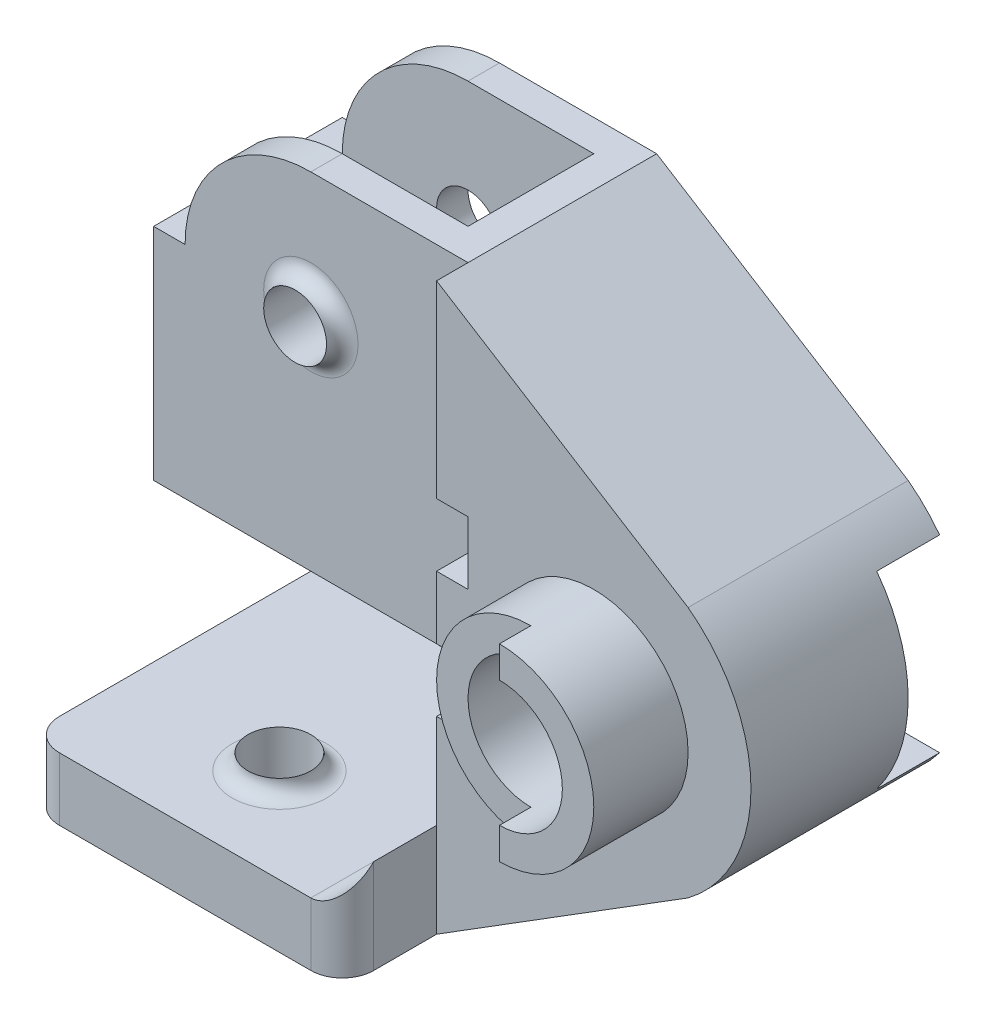
from build123d import *
from build123d.topology import SkipClean

# Parameters (mm, degrees)
SKETCH1_R           = 1
BOSS_EXTRUDE1_DEPTH = 10
SKETCH2_W           = 1
SKETCH2_H           = 2
SKETCH2_W_2         = 2
SKETCH2_H_2         = 3
CUT_EXTRUDE1_DEPTH  = 20
SKETCH3_W           = 11.356791525
SKETCH3_H           = 18.189557321
SKETCH3_R           = 3
CUT_EXTRUDE2_DEPTH  = 3
SKETCH4_R           = 2
CUT_EXTRUDE3_DEPTH  = 4
CUT_EXTRUDE4_START  = -2
CUT_EXTRUDE4_DEPTH  = 2
CUT_EXTRUDE5_START  = -2
SKETCH6_R           = 2
CUT_EXTRUDE5_DEPTH  = 2
SKETCH7_W           = 8
SKETCH7_H           = 4
CUT_EXTRUDE6_DEPTH  = 8
FILLET1_R           = 1
SKETCH9_R           = 1
CUT_EXTRUDE8_DEPTH  = 3
CUT_EXTRUDE9_DEPTH  = 9
CUT_EXTRUDE10_START = -4
SKETCH11_R          = 1
CUT_EXTRUDE10_DEPTH = 4
CUT_EXTRUDE11_DEPTH = 4
CUT_EXTRUDE12_DEPTH = 27
SKETCH14_R          = 1
CUT_EXTRUDE13_DEPTH = 27


with BuildPart() as part:
    # Sketch1 → Boss-Extrude1 (new body)
    with BuildSketch(Plane.XY):
        with BuildLine():
            Line((0, 0), (0, 14))
            Line((0, 14), (1, 14))
            ThreePointArc((1, 14), (2.171572875, 16.828427125), (5, 18))
            Line((5, 18), (10, 18))
            Line((10, 18), (18, 13))
            ThreePointArc((18, 13), (20, 9), (18, 5))
            Line((18, 5), (10, 0))
            Line((10, 0), (0, 0))
        make_face()
        with Locations((5, 14)):
            Circle(SKETCH1_R, mode=Mode.SUBTRACT)
        with Locations((15, 9)):
            Circle(SKETCH1_R, mode=Mode.SUBTRACT)
    extrude(amount=BOSS_EXTRUDE1_DEPTH)

    # Sketch2 → Cut-Extrude1 (cut)
    with BuildSketch(Plane(origin=(0, 18, 0), x_dir=(1, 0, 0), z_dir=(0, 1, 0))):
        with Locations((19.5, -1)):
            Rectangle(SKETCH2_W, SKETCH2_H)
        with Locations((19, -8.5)):
            Rectangle(SKETCH2_W_2, SKETCH2_H_2)
        Polygon((10, -7), (10, -10), (15, -10), (15, -9), (12, -9), (12, -7), align=None)
    extrude(amount=-CUT_EXTRUDE1_DEPTH, mode=Mode.SUBTRACT)

    # Sketch3 → Cut-Extrude2 (cut)
    with BuildSketch(Plane.XY.offset(10)):
        with Locations((15.678395763, 9.094778661)):
            Rectangle(SKETCH3_W, SKETCH3_H)
        with Locations((15, 9)):
            Circle(SKETCH3_R, mode=Mode.SUBTRACT)
    extrude(amount=-CUT_EXTRUDE2_DEPTH, mode=Mode.SUBTRACT)

    # Sketch4 → Cut-Extrude3 (cut)
    with BuildSketch(Plane.XY.offset(10)):
        with Locations((15, 9)):
            Circle(SKETCH4_R)
    extrude(amount=-CUT_EXTRUDE3_DEPTH, mode=Mode.SUBTRACT)

    # Sketch5 → Cut-Extrude4 (cut)
    with BuildSketch(Plane(origin=(0, 0, 0), x_dir=(-1, 0, 0), z_dir=(0, 0, -1)).offset(CUT_EXTRUDE4_START)):
        with BuildLine():
            Line((-15, 6), (-23.076049943, 6))
            ThreePointArc((-23.076049943, 6), (-26.076049943, 9), (-23.076049943, 12))
            Line((-23.076049943, 12), (-15, 12))
            ThreePointArc((-15, 12), (-12, 9), (-15, 6))
        make_face()
    extrude(amount=CUT_EXTRUDE4_DEPTH, mode=Mode.SUBTRACT)

    # Sketch6 → Cut-Extrude5 (cut)
    with BuildSketch(Plane(origin=(0, 0, 2), x_dir=(-1, 0, 0), z_dir=(0, 0, -1)).offset(CUT_EXTRUDE5_START)):
        with Locations((-15, 9)):
            Circle(SKETCH6_R)
    extrude(amount=CUT_EXTRUDE5_DEPTH, mode=Mode.SUBTRACT)

    # Sketch7 → Cut-Extrude6 (cut)
    with BuildSketch(Plane(origin=(0, 18, 0), x_dir=(1, 0, 0), z_dir=(0, 1, 0))):
        with Locations((5, -3)):
            Rectangle(SKETCH7_W, SKETCH7_H)
    extrude(amount=-CUT_EXTRUDE6_DEPTH, mode=Mode.SUBTRACT)

    # Fillet1
    fillet1_edges = [part.edges().sort_by_distance(p)[0] for p in [
        (1, 10, 3),
        (9, 10, 3),
    ]]
    fillet(fillet1_edges, radius=FILLET1_R)

    # Sketch9 → Cut-Extrude8 (cut)
    with BuildSketch(Plane(origin=(0, 10, 0), x_dir=(1, 0, 0), z_dir=(0, 1, 0))):
        with Locations((7, -3)):
            Circle(SKETCH9_R)
        with Locations((3, -3)):
            Circle(SKETCH9_R)
    extrude(amount=-CUT_EXTRUDE8_DEPTH, mode=Mode.SUBTRACT)

    # Sketch10 → Cut-Extrude9 (cut)
    with BuildSketch(Plane.XY.offset(10)):
        with BuildLine():
            Line((0, 7), (9, 7))
            ThreePointArc((9, 7), (9.707106781, 6.707106781), (10, 6))
            Line((10, 6), (10, 3))
            ThreePointArc((10, 3), (9.707106781, 2.292893219), (9, 2))
            Line((9, 2), (0, 2))
            Line((0, 2), (0, 7))
        make_face()
    extrude(amount=-CUT_EXTRUDE9_DEPTH, mode=Mode.SUBTRACT)

    # Sketch11 → Cut-Extrude10 (cut)
    with BuildSketch(Plane.XY.offset(10).offset(CUT_EXTRUDE10_START)):
        with BuildLine():
            Line((10, 8), (10, 10))
            Line((10, 10), (11, 10))
            Line((11, 10), (11, 12))
            Line((11, 12), (10, 12))
            Line((10, 12), (10, 18))
            Line((10, 18), (5, 18))
            ThreePointArc((5, 18), (2.171572875, 16.828427125), (1, 14))
            Line((1, 14), (0, 14))
            Line((0, 14), (0, 7))
            Line((0, 7), (9, 7))
            ThreePointArc((9, 7), (9.707106781, 6.707106781), (10, 6))
            Line((10, 6), (11, 6))
            Line((11, 6), (11, 8))
            Line((11, 8), (10, 8))
        make_face()
        with Locations((5, 14)):
            Circle(SKETCH11_R, mode=Mode.SUBTRACT)
    extrude(amount=CUT_EXTRUDE10_DEPTH, mode=Mode.SUBTRACT)

    # Sketch12 → Cut-Extrude11 (cut)
    with BuildSketch(Plane.XY.offset(1)):
        with BuildLine():
            Line((2, 4), (-2.189178963, 4))
            ThreePointArc((-2.189178963, 4), (-3.189178963, 5), (-2.189178963, 6))
            Line((-2.189178963, 6), (2, 6))
            ThreePointArc((2, 6), (3, 5), (2, 4))
        make_face()
    extrude(amount=-CUT_EXTRUDE11_DEPTH, mode=Mode.SUBTRACT)

    # Sketch13 → Cut-Extrude12 (cut)
    with BuildSketch(Plane(origin=(0, 18, 0), x_dir=(1, 0, 0), z_dir=(0, 1, 0))):
        with BuildLine():
            Line((10, -9), (10, -10))
            Line((10, -10), (9, -10))
            ThreePointArc((9, -10), (9.707106781, -9.707106781), (10, -9))
        make_face()
        with BuildLine():
            Line((1, -10), (0, -10))
            Line((0, -10), (0, -9))
            ThreePointArc((0, -9), (0.292893219, -9.707106781), (1, -10))
        make_face()
    extrude(amount=-CUT_EXTRUDE12_DEPTH, mode=Mode.SUBTRACT)

    # Sketch14 → Cut-Extrude13 (cut)
    with BuildSketch(Plane(origin=(0, 2, 0), x_dir=(1, 0, 0), z_dir=(0, 1, 0))):
        with Locations((5, -7)):
            Circle(SKETCH14_R)
    extrude(amount=-CUT_EXTRUDE13_DEPTH, mode=Mode.SUBTRACT)

    # Sketch15 → Revolve1 (revolve)
    with SkipClean():  # the faces are left unmerged after this step: merging them gives an invalid solid
        with BuildSketch(Plane.XY.offset(7)):
            with BuildLine():
                Line((4, 2), (4, 2.5))
                ThreePointArc((4, 2.5), (3.853553391, 2.146446609), (3.5, 2))
                Line((3.5, 2), (4, 2))
            make_face()
        revolve(axis=Axis((5, 0, 7), (0, 1, 0)))

    # Sketch16 → Revolve2 (revolve)
    with SkipClean():  # the faces are left unmerged after this step: merging them gives an invalid solid
        with BuildSketch(Plane(origin=(0, 14, 0), x_dir=(1, 0, 0), z_dir=(0, 1, 0))):
            with BuildLine():
                Line((4, -6), (4, -6.5))
                ThreePointArc((4, -6.5), (3.853553391, -6.146446609), (3.5, -6))
                Line((3.5, -6), (4, -6))
            make_face()
        revolve(axis=Axis((5, 14, 5), (0, 0, 1)))
    add(part.part.scale(1), mode=Mode.REPLACE)  # the faces are merged on a copy


solid = part.part
